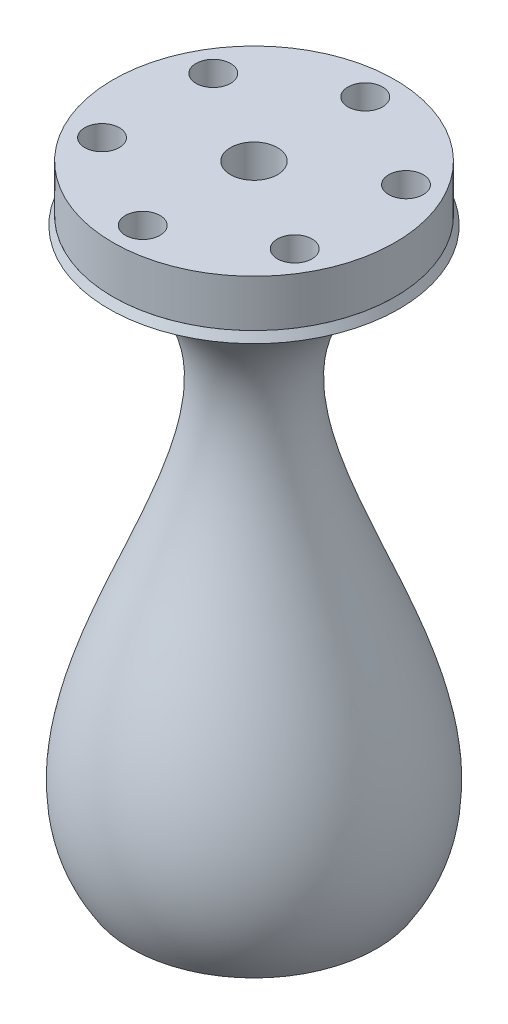
from build123d import *

# Parameters (mm, degrees)
SKETCH1_R                 = 38.1
SKETCH1_R_2               = 4.673297919
BOSS_EXTRUDE1_DEPTH       = 12.7
REVOLVE_THIN2_OUTLINE_W   = 31.75
REVOLVE_THIN2_OUTLINE_H   = 2.54
REVOLVE_THIN2_OUTLINE_W_2 = 1.420230581
SKETCH3_R                 = 6.35
CUT_EXTRUDE1_DEPTH        = 12.7


# Read off the part's stored shape, not the designer's step: Revolve-Thin2
with BuildPart() as part:
    # Sketch1 → Boss-Extrude1 (new body)
    with BuildSketch(Plane(origin=(0, 0, 0), x_dir=(1, 0, 0), z_dir=(0, 1, 0))):
        with Locations(Location((0, 0, 0), (0, 0, 270))):
            Circle(SKETCH1_R)
        with Locations(Location((0, 30.054137764, 0), (0, 0, 270))):
            Circle(SKETCH1_R_2, mode=Mode.SUBTRACT)
        with Locations(Location((26.027646793, 15.027068882, 0), (0, 0, 270))):
            Circle(SKETCH1_R_2, mode=Mode.SUBTRACT)
        with Locations(Location((26.027646793, -15.027068882, 0), (0, 0, 270))):
            Circle(SKETCH1_R_2, mode=Mode.SUBTRACT)
        with Locations(Location((0, -30.054137764, 0), (0, 0, 270))):
            Circle(SKETCH1_R_2, mode=Mode.SUBTRACT)
        with Locations(Location((-26.027646793, -15.027068882, 0), (0, 0, 270))):
            Circle(SKETCH1_R_2, mode=Mode.SUBTRACT)
        with Locations(Location((-26.027646793, 15.027068882, 0), (0, 0, 270))):
            Circle(SKETCH1_R_2, mode=Mode.SUBTRACT)
    extrude(amount=BOSS_EXTRUDE1_DEPTH)

    # Sketch3 → Cut-Extrude1 (cut)
    with BuildSketch(Plane(origin=(0, 12.7, 0), x_dir=(1, 0, 0), z_dir=(0, 1, 0))):
        with Locations(Location((0, 0, 0), (0, 0, 270))):
            Circle(SKETCH3_R)
    extrude(amount=-CUT_EXTRUDE1_DEPTH, mode=Mode.SUBTRACT)


with BuildPart() as body_2:
    # Revolve-Thin2 outline → Revolve-Thin2 (revolve)
    with BuildSketch(Plane.XY):
        with BuildLine():
            Line((38.1, -2.292226029), (38.1, 0))
            add(Edge.make_bspline(
                [(38.1, 0), (36.539197313, -0.745061332), (35.057666949, -1.509378852), (33.652373459, -2.292226029)],
                knots=[0, 0, 0, 0, 0.022052636, 0.022052636, 0.022052636, 0.022052636], degree=3))
            Line((33.652373459, -2.292226029), (38.1, -2.292226029))
        make_face()
        Polygon((39.194211967, -2.292226029), (38.1, 0), (38.1, -2.292226029), align=None)
        with BuildLine():
            Line((38.1, -2.292226029), (33.652373459, -2.292226029))
            add(Edge.make_bspline(
                [(33.652373459, -2.292226029), (33.490651057, -2.382316766), (33.329938307, -2.472652902), (33.170230581, -2.56323333)],
                knots=[0.022052636, 0.022052636, 0.022052636, 0.022052636, 0.024590473, 0.024590473, 0.024590473, 0.024590473], degree=3))
            Line((33.170230581, -2.56323333), (33.170230581, -5.501288375))
            add(Edge.make_bspline(
                [(38.1, -2.82441559), (36.344967316, -3.694174846), (34.703616491, -4.587145765), (33.170230581, -5.501288375)],
                knots=[0.005330764, 0.005330764, 0.005330764, 0.005330764, 0.031323112, 0.031323112, 0.031323112, 0.031323112], degree=3))
            Line((38.1, -2.82441559), (38.1, -2.292226029))
        make_face()
        with BuildLine():
            add(Edge.make_bspline(
                [(39.194211967, -2.292226029), (38.824660103, -2.468634494), (38.459939219, -2.64603688), (38.1, -2.82441559)],
                knots=[0, 0, 0, 0, 0.005330764, 0.005330764, 0.005330764, 0.005330764], degree=3))
            Line((39.194211967, -2.292226029), (38.1, -2.292226029))
            Line((38.1, -2.292226029), (38.1, -2.82441559))
        make_face()
        with BuildLine():
            Line((33.170230581, -5.501288375), (33.170230581, -2.56323333))
            add(Edge.make_bspline(
                [(33.170230581, -2.56323333), (32.687688134, -2.836913901), (32.214320475, -3.112824595), (31.75, -3.390934871)],
                knots=[0.024590473, 0.024590473, 0.024590473, 0.024590473, 0.032258317, 0.032258317, 0.032258317, 0.032258317], degree=3))
            Line((31.75, -3.390934871), (31.75, -6.373378427))
            add(Edge.make_bspline(
                [(33.170230581, -5.501288375), (32.686118905, -5.78989616), (32.21276868, -6.080614242), (31.75, -6.373378427)],
                knots=[0.031323112, 0.031323112, 0.031323112, 0.031323112, 0.039529265, 0.039529265, 0.039529265, 0.039529265], degree=3))
        make_face()
        with BuildLine():
            Line((39.194211967, -139.075003135), (39.194211967, -124.719049732))
            add(Edge.make_bspline(
                [(38.1, -118.322164828), (38.555159427, -120.466291268), (38.925786358, -122.599458417), (39.194211967, -124.719049732)],
                knots=[0.771095938, 0.771095938, 0.771095938, 0.771095938, 0.809059932, 0.809059932, 0.809059932, 0.809059932], degree=3))
            Line((38.1, -118.322164828), (38.1, -144.18985569))
            add(Edge.make_bspline(
                [(39.194211967, -139.075003135), (38.938120201, -140.799443905), (38.577139446, -142.506069221), (38.1, -144.18985569)],
                knots=[0.896322274, 0.896322274, 0.896322274, 0.896322274, 0.928477073, 0.928477073, 0.928477073, 0.928477073], degree=3))
        make_face()
        with BuildLine():
            add(Edge.make_bspline(
                [(39.194211967, -124.719049732), (39.218535072, -124.911114272), (39.242019012, -125.103067342), (39.537567265, -127.608316448), (39.686511355, -129.905563915), (39.686511354, -132.181223793)],
                knots=[0.809059932, 0.809059932, 0.809059932, 0.809059932, 0.8125, 0.8125, 0.853984044, 0.853984044, 0.853984044, 0.853984044], degree=3))
            Line((39.194211967, -124.719049732), (39.194211967, -139.075003135))
            add(Edge.make_bspline(
                [(39.686511354, -132.181223793), (39.686511353, -133.334080702), (39.648285306, -134.481397223), (39.487725952, -136.780170301), (39.364029809, -137.931503617), (39.194211967, -139.075003135)],
                knots=[0.853984044, 0.853984044, 0.853984044, 0.853984044, 0.875, 0.875, 0.896322274, 0.896322274, 0.896322274, 0.896322274], degree=3))
        make_face()
        with BuildLine():
            Line((31.75, -6.373378427), (31.75, -3.390934871))
            add(Edge.make_bspline(
                [(31.75, -3.390934871), (-8.411459711, -27.446119247), (19.112756517, -67.957268122), (31.75, -105.160741295)],
                knots=[0.032258317, 0.032258317, 0.032258317, 0.032258317, 0.695489473, 0.695489473, 0.695489473, 0.695489473], degree=3))
            Line((31.75, -105.160741295), (31.75, -97.644710533))
            add(Edge.make_bspline(
                [(31.75, -6.373378427), (30.454613848, -7.192886502), (29.242140125, -8.028426952), (25.024525947, -11.19176543), (22.52480318, -13.611794296), (18.506197427, -18.634015258), (16.985107262, -21.236489796), (14.741227924, -26.643112888), (14.018468362, -29.449773942), (13.244697696, -35.288163279), (13.195326219, -38.319864475), (13.66204339, -44.585476721), (14.178435247, -47.818456499), (16.393561816, -57.752220302), (18.760252087, -64.684360956), (24.179615, -78.82236222), (27.229974955, -86.028332185), (30.630130329, -94.703924675), (31.197238405, -96.174792352), (31.75, -97.644710533)],
                knots=[0.039529265, 0.039529265, 0.039529265, 0.039529265, 0.0625, 0.0625, 0.125, 0.125, 0.1875, 0.1875, 0.25, 0.25, 0.3125, 0.3125, 0.375, 0.375, 0.5, 0.5, 0.625, 0.625, 0.650520379, 0.650520379, 0.650520379, 0.650520379], degree=3))
        make_face()
        with BuildLine():
            Line((38.1, -144.18985569), (38.1, -118.322164828))
            add(Edge.make_bspline(
                [(33.170230581, -101.515907435), (34.751629562, -105.947270442), (36.162444489, -110.362841801), (37.568049279, -115.935872582), (37.847075753, -117.130710728), (38.1, -118.322164828)],
                knots=[0.672940205, 0.672940205, 0.672940205, 0.672940205, 0.75, 0.75, 0.771095938, 0.771095938, 0.771095938, 0.771095938], degree=3))
            Line((33.170230581, -101.515907435), (33.170230581, -109.544472525))
            add(Edge.make_bspline(
                [(33.170230581, -109.544472525), (37.611754839, -124.008078255), (39.267693579, -137.844187385), (33.170230581, -149.863760519)],
                knots=[0.721638111, 0.721638111, 0.721638111, 0.721638111, 0.981519206, 0.981519206, 0.981519206, 0.981519206], degree=3))
            Line((33.170230581, -149.863760519), (33.170230581, -152.4))
            Line((33.170230581, -152.4), (34.69514339, -152.4))
            add(Edge.make_bspline(
                [(38.1, -144.18985569), (37.966110371, -144.66234135), (37.823074241, -145.133028648), (37.14271093, -147.22537189), (36.502268631, -148.825657092), (35.414709578, -151.07002332), (35.066294719, -151.737914019), (34.69514339, -152.4)],
                knots=[0.928477073, 0.928477073, 0.928477073, 0.928477073, 0.9375, 0.9375, 0.96875, 0.96875, 0.98214115, 0.98214115, 0.98214115, 0.98214115], degree=3))
        make_face()
        with BuildLine():
            Line((31.75, -97.644710533), (31.75, -105.160741295))
            add(Edge.make_bspline(
                [(31.75, -105.160741295), (32.248237614, -106.627530291), (32.723334622, -108.089177771), (33.170230581, -109.544472525)],
                knots=[0.695489473, 0.695489473, 0.695489473, 0.695489473, 0.721638111, 0.721638111, 0.721638111, 0.721638111], degree=3))
            Line((33.170230581, -109.544472525), (33.170230581, -101.515907435))
            add(Edge.make_bspline(
                [(31.75, -97.644710533), (32.235604801, -98.936043601), (32.710137359, -100.226643871), (33.170230581, -101.515907435)],
                knots=[0.650520379, 0.650520379, 0.650520379, 0.650520379, 0.672940205, 0.672940205, 0.672940205, 0.672940205], degree=3))
        make_face()
        with Locations((15.875, -153.67)):
            Rectangle(REVOLVE_THIN2_OUTLINE_W, REVOLVE_THIN2_OUTLINE_H)
        with BuildLine():
            add(Edge.make_bspline(
                [(33.170230581, -149.863760519), (32.736624745, -150.718502411), (32.263810051, -151.564058104), (31.75, -152.4)],
                knots=[0.981519206, 0.981519206, 0.981519206, 0.981519206, 1, 1, 1, 1], degree=3))
            Line((31.75, -152.4), (33.170230581, -152.4))
            Line((33.170230581, -152.4), (33.170230581, -149.863760519))
        make_face()
        with Locations((32.460115291, -153.67)):
            Rectangle(REVOLVE_THIN2_OUTLINE_W_2, REVOLVE_THIN2_OUTLINE_H)
        with BuildLine():
            add(Edge.make_bspline(
                [(34.69514339, -152.4), (34.633229636, -152.51044613), (34.570683187, -152.620730731), (34.397017878, -152.92341622), (34.228379289, -153.211512947), (34.040921715, -153.522373425), (33.968056415, -153.641733741), (33.938848947, -153.689461715), (33.923533911, -153.71441515), (33.882444639, -153.781265233), (33.635909003, -154.182365729), (33.389373368, -154.583466226), (33.170230581, -154.94)],
                knots=[0.98214115, 0.98214115, 0.98214115, 0.98214115, 0.984375, 0.984375, 0.98828125, 0.990234375, 0.990722656, 0.990722656, 0.991210937, 0.991210937, 0.9921875, 1, 1, 1, 1], degree=3))
            Line((34.69514339, -152.4), (33.170230581, -152.4))
            Line((33.170230581, -152.4), (33.170230581, -154.94))
        make_face()
    revolve(axis=Axis((0, 0, 0), (0, 1, 0)))


solid = Compound([part.part, body_2.part])
